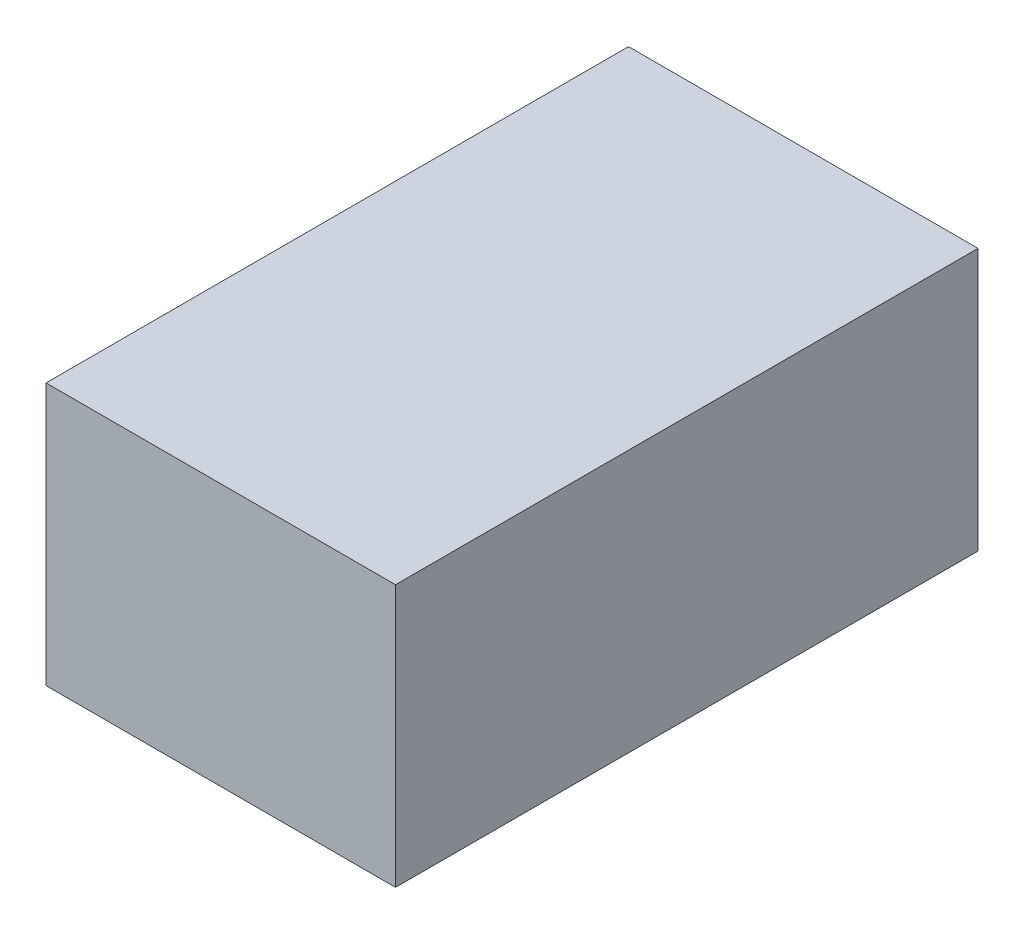
from build123d import *

# Parameters (mm, degrees)
BOSS_EXTRUDE1_DEPTH      = 12
BOSS_EXTRUDE2_START      = -2
BOSS_EXTRUDE2_DEPTH      = 2
SKETCH4_W                = 6
SKETCH4_H                = 4.8
BOSS_EXTRUDE3_DEPTH      = 22
BOSS_EXTRUDE4_DEPTH      = 3
BOSS_EXTRUDE4_DEPTH_BACK = 1.5
SKETCH5_W                = 6
SKETCH5_H                = 10
INTERSECT1_START         = -2
INTERSECT1_DEPTH         = 20.5


# Read off the part's stored shape, not the designer's step: Intersect1
with BuildPart() as part:
    # Sketch1 → Boss-Extrude1 (new body)
    with BuildSketch(Plane(origin=(0, 0, 0), x_dir=(1, 0, 0), z_dir=(0, 1, 0))):
        with BuildLine():
            Line((2.5, 27.386127875), (2.5, 25.377155081))
            ThreePointArc((2.5, 25.377155081), (25.5, 0), (2.5, -25.377155081))
            Line((2.5, -25.377155081), (2.5, -27.386127875))
            ThreePointArc((2.5, -27.386127875), (27.5, 0), (2.5, 27.386127875))
        make_face()
    extrude(amount=BOSS_EXTRUDE1_DEPTH)

    # Sketch2 → Boss-Extrude2 (add)
    with BuildSketch(Plane(origin=(0, 0, 0), x_dir=(1, 0, 0), z_dir=(0, 1, 0)).offset(BOSS_EXTRUDE2_START)):
        with BuildLine():
            Line((2.5, 27.386127875), (1.863636364, 20.415113507))
            ThreePointArc((1.863636364, 20.415113507), (20.5, 0), (1.863636364, -20.415113507))
            Line((1.863636364, -20.415113507), (2.5, -27.386127875))
            ThreePointArc((2.5, -27.386127875), (27.5, 0), (2.5, 27.386127875))
        make_face()
    extrude(amount=BOSS_EXTRUDE2_DEPTH)

    # Sketch4 → Boss-Extrude3 (add)
    with BuildSketch(Plane(origin=(0, -2, 0), x_dir=(1, 0, 0), z_dir=(0, 1, 0))):
        with Locations((30, 0)):
            Rectangle(SKETCH4_W, SKETCH4_H)
    extrude(amount=BOSS_EXTRUDE3_DEPTH)

    # Sketch5 → Boss-Extrude4 (add, two sides: drawn at the far end of the back side and taken through both)
    with BuildSketch(Plane(origin=(0, 20, 0), x_dir=(1, 0, 0), z_dir=(0, 1, 0)).offset(-BOSS_EXTRUDE4_DEPTH_BACK)):
        with Locations((30, 0)):
            Rectangle(SKETCH5_W, SKETCH5_H)
    extrude(amount=BOSS_EXTRUDE4_DEPTH + BOSS_EXTRUDE4_DEPTH_BACK)

    # Intersect1 outline → Intersect1 (cut)
    with BuildSketch(Plane(origin=(0, 0, 0), x_dir=(1, 0, 0), z_dir=(0, 1, 0)).offset(INTERSECT1_START)):
        with BuildLine():
            ThreePointArc((2.5, -27.386127875), (19.480900576, -19.409907593), (27.39507255, -2.4))
            Line((27.39507255, -2.4), (33, -2.4))
            Line((33, -2.4), (33, 2.4))
            Line((33, 2.4), (27.39507255, 2.4))
            ThreePointArc((27.39507255, 2.4), (19.480900576, 19.409907593), (2.5, 27.386127875))
            Line((2.5, 27.386127875), (1.863636364, 20.415113507))
            ThreePointArc((1.863636364, 20.415113507), (20.5, 0), (1.863636364, -20.415113507))
            Line((1.863636364, -20.415113507), (2.5, -27.386127875))
        make_face()
    extrude(amount=INTERSECT1_DEPTH, mode=Mode.SUBTRACT)


solid = part.part
